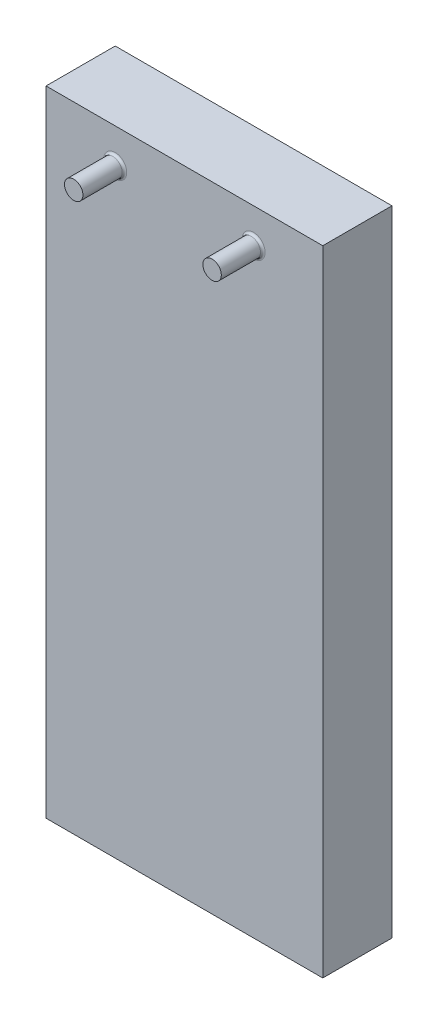
from build123d import *

# Parameters (mm, degrees)
SKETCH1_W           = 120
SKETCH1_H           = 30
BOSS_EXTRUDE1_DEPTH = 275
SKETCH2_R           = 4
BOSS_EXTRUDE2_DEPTH = 18
FILLET1_R           = 1


with BuildPart() as part:
    # Sketch1 → Boss-Extrude1 (new body)
    with BuildSketch(Plane(origin=(0, 0, 0), x_dir=(1, 0, 0), z_dir=(0, 1, 0))):
        Rectangle(SKETCH1_W, SKETCH1_H)
    extrude(amount=BOSS_EXTRUDE1_DEPTH)

    # Sketch2 → Boss-Extrude2 (add)
    with BuildSketch(Plane.XY.offset(15)):
        with Locations((-30, 260)):
            Circle(SKETCH2_R)
        with Locations((30, 260)):
            Circle(SKETCH2_R)
    extrude(amount=BOSS_EXTRUDE2_DEPTH)

    # Fillet1
    fillet1_edges = [part.edges().sort_by_distance(p)[0] for p in [
        (26, 260, 15),
        (-34, 260, 15),
    ]]
    fillet(fillet1_edges, radius=FILLET1_R)


solid = part.part
